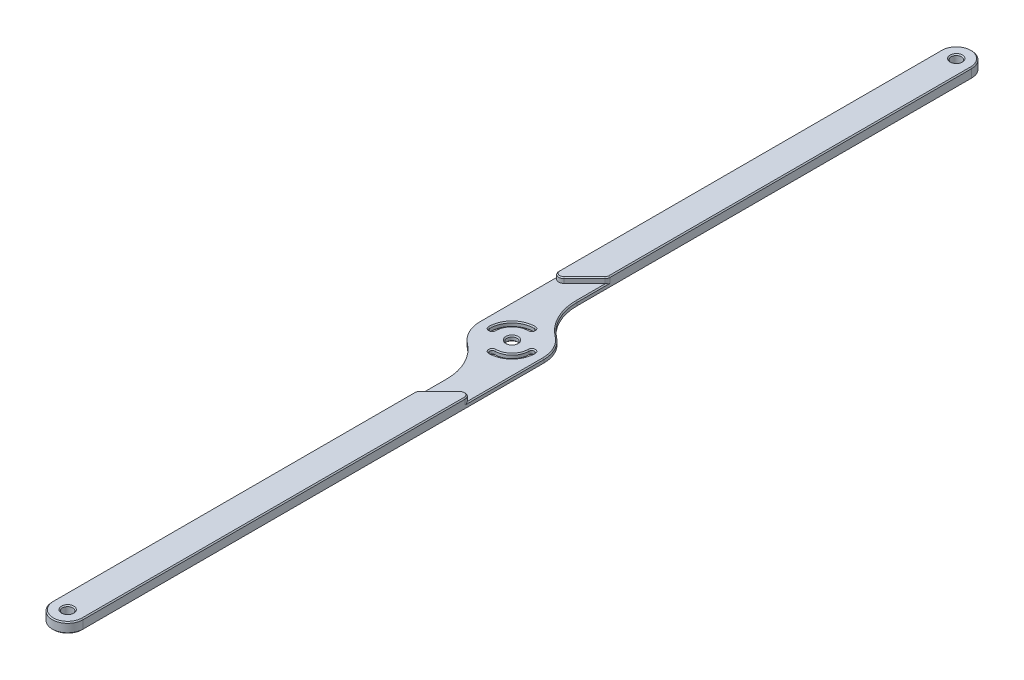
from build123d import *

# Parameters (mm, degrees)
SKETCH_1_R          = 1
EXTRUDE_1_DEPTH     = 2
EXTRUDE_1_2_DEPTH   = 2
EXTRUDE_2_DEPTH     = 1
SKETCH_2_R          = 1
CUT_EXTRUDE_1_DEPTH = 3.5
CHAMFER_1_SIZE      = 0.2
CHAMFER_2_SIZE      = 0.2
CHAMFER_4_SIZE      = 0.2
CHAMFER_5_SIZE      = 0.2
CHAMFER_6_SIZE      = 0.2


with BuildPart() as part:
    # 草图1 → 凸台-拉伸1 (new body)
    with BuildSketch(Plane(origin=(0, 0, 0), x_dir=(1, 0, 0), z_dir=(0, 1, 0))):
        with BuildLine():
            Line((-32.564554557, -24.990133986), (-36.564554557, -28.990133986))
            ThreePointArc((-36.564554557, -28.990133986), (-36.781327308, -29.314557334), (-36.857447775, -29.697240767))
            Line((-36.857447775, -29.697240767), (-36.857447775, -100.283027204))
            ThreePointArc((-36.857447775, -100.283027204), (-33.857447775, -103.283027204), (-30.857447775, -100.283027204))
            Line((-30.857447775, -100.283027204), (-30.857447775, -25.697240767))
            ThreePointArc((-30.857447775, -25.697240767), (-31.474764343, -24.773361234), (-32.564554557, -24.990133986))
        make_face()
        with Locations((-33.857447775, -100.283027204)):
            Circle(SKETCH_1_R, mode=Mode.SUBTRACT)
    extrude(amount=EXTRUDE_1_DEPTH)



with BuildPart() as body_2:
    # 草图1 → Extrude 1 2 (new body)
    with BuildSketch(Plane(origin=(0, 0, 0), x_dir=(1, 0, 0), z_dir=(0, 1, 0))):
        with BuildLine():
            Line((-43.286707561, 79.575105321), (-43.286707561, 4.989318884))
            ThreePointArc((-43.286707561, 4.989318884), (-42.669390994, 4.065439351), (-41.57960078, 4.282212103))
            Line((-41.57960078, 4.282212103), (-37.57960078, 8.282212103))
            ThreePointArc((-37.57960078, 8.282212103), (-37.362828029, 8.606635451), (-37.286707561, 8.989318884))
            Line((-37.286707561, 8.989318884), (-37.286707561, 79.575105321))
            ThreePointArc((-37.286707561, 79.575105321), (-40.286707561, 82.575105321), (-43.286707561, 79.575105321))
        make_face()
        with Locations((-40.286707561, 79.575105321)):
            Circle(SKETCH_1_R, mode=Mode.SUBTRACT)
    extrude(amount=EXTRUDE_1_2_DEPTH)


with BuildPart() as part_1:
    add(part.part)

    add(body_2.part)  # 凸台-拉伸2 merges body 2
    # 草图1<3> → 凸台-拉伸2 (add)
    with BuildSketch(Plane(origin=(0, 0, 0), x_dir=(1, 0, 0), z_dir=(0, 1, 0))):
        with BuildLine():
            ThreePointArc((-36.857447775, -29.697240767), (-36.781327308, -29.314557334), (-36.564554557, -28.990133986))
            Line((-36.564554557, -28.990133986), (-32.564554557, -24.990133986))
            ThreePointArc((-32.564554557, -24.990133986), (-31.474764343, -24.773361234), (-30.857447775, -25.697240767))
            Line((-30.857447775, -25.697240767), (-30.857447775, -10.353960941))
            ThreePointArc((-30.857447775, -10.353960941), (-31.507484403, -7.586845747), (-33.321609481, -5.398598888))
            ThreePointArc((-33.321609481, -5.398598888), (-36.24072954, -1.87747712), (-37.286707561, 2.575105321))
            Line((-37.286707561, 2.575105321), (-37.286707561, 8.989318884))
            ThreePointArc((-37.286707561, 8.989318884), (-37.362828029, 8.606635451), (-37.57960078, 8.282212103))
            Line((-37.57960078, 8.282212103), (-41.57960078, 4.282212103))
            ThreePointArc((-41.57960078, 4.282212103), (-42.669390994, 4.065439351), (-43.286707561, 4.989318884))
            Line((-43.286707561, 4.989318884), (-43.286707561, -10.353960941))
            ThreePointArc((-43.286707561, -10.353960941), (-42.636670934, -13.121076136), (-40.822545856, -15.309322995))
            ThreePointArc((-40.822545856, -15.309322995), (-37.903425797, -18.830444763), (-36.857447775, -23.283027204))
            Line((-36.857447775, -23.283027204), (-36.857447775, -29.697240767))
        make_face()
    extrude(amount=EXTRUDE_2_DEPTH)

    # 草图2 → 切除-拉伸1 (cut)
    with BuildSketch(Plane(origin=(0, 1, 0), x_dir=(1, 0, 0), z_dir=(0, 1, 0))):
        with Locations((-37.072077668, -10.353960941)):
            Circle(SKETCH_2_R)
        with BuildLine():
            ThreePointArc((-37.072077668, -5.999383373), (-40.151228996, -7.274809613), (-41.426655237, -10.353960941))
            ThreePointArc((-41.426655237, -10.353960941), (-40.926655237, -10.853960941), (-40.426655237, -10.353960941))
            ThreePointArc((-40.426655237, -10.353960941), (-39.444122215, -7.981916395), (-37.072077668, -6.999383373))
            ThreePointArc((-37.072077668, -6.999383373), (-36.572077668, -6.499383373), (-37.072077668, -5.999383373))
        make_face()
        with BuildLine():
            ThreePointArc((-37.072077668, -14.70853851), (-33.99292634, -13.43311227), (-32.7175001, -10.353960941))
            ThreePointArc((-32.7175001, -10.353960941), (-33.2175001, -9.853960941), (-33.7175001, -10.353960941))
            ThreePointArc((-33.7175001, -10.353960941), (-34.700033121, -12.726005488), (-37.072077668, -13.70853851))
            ThreePointArc((-37.072077668, -13.70853851), (-37.572077668, -14.20853851), (-37.072077668, -14.70853851))
        make_face()
    extrude(amount=-CUT_EXTRUDE_1_DEPTH, mode=Mode.SUBTRACT)

    # 倒角1
    chamfer_1_edges = [part_1.edges().sort_by_distance(p)[0] for p in [
        (-30.857447775, 0, 55.318494073),
        (-31.507484403, 0, 7.586845747),
        (-36.24072954, 0, 1.87747712),
        (-36.857447775, 0, 61.783027204),
        (-37.286707561, 0, -41.075105321),
        (-37.903425797, 0, 18.830444763),
        (-42.636670934, 0, 13.121076136),
        (-43.286707561, 0, -34.61057219),
        (-37.362828029, 2, -8.606635451),
        (-37.286707561, 2, -44.282212103),
        (-39.57960078, 2, -6.282212103),
        (-42.669390994, 2, -4.065439351),
        (-43.286707561, 2, -42.282212103),
        (-33.857447775, 0, 103.283027204),
        (-40.286707561, 0, -82.575105321),
        (-40.286707561, 2, -82.575105321),
    ]]
    chamfer(chamfer_1_edges, length=CHAMFER_1_SIZE)

    # 倒角2
    chamfer_2_edges = [part_1.edges().sort_by_distance(p)[0] for p in [
        (-36.781327308, 2, 29.314557334),
        (-34.564554557, 2, 26.990133986),
        (-36.857447775, 2, 64.990133986),
        (-31.474764343, 2, 24.773361234),
        (-30.857447775, 2, 62.990133986),
        (-33.857447775, 2, 103.283027204),
    ]]
    chamfer(chamfer_2_edges, length=CHAMFER_2_SIZE)

    # 倒角4
    chamfer_4_edges = [part_1.edges().sort_by_distance(p)[0] for p in [
        (-37.286707561, 1, -5.782212103),
        (-36.24072954, 1, 1.87747712),
        (-31.507484403, 1, 7.586845747),
        (-30.857447775, 1, 18.025600854),
    ]]
    chamfer(chamfer_4_edges, length=CHAMFER_4_SIZE)

    # 倒角5
    chamfer_5_edges = [part_1.edges().sort_by_distance(p)[0] for p in [
        (-33.99292634, 0, 13.43311227),
        (-33.2175001, 0, 9.853960941),
        (-37.572077668, 0, 14.20853851),
        (-34.700033121, 0, 12.726005488),
        (-33.99292634, 1, 13.43311227),
        (-33.2175001, 1, 9.853960941),
        (-37.572077668, 1, 14.20853851),
        (-34.700033121, 1, 12.726005488),
        (-38.072077668, 0, 10.353960941),
        (-38.072077668, 1, 10.353960941),
        (-39.444122215, 1, 7.981916395),
        (-36.572077668, 1, 6.499383373),
        (-40.926655237, 1, 10.853960941),
        (-40.151228996, 1, 7.274809613),
        (-39.444122215, 0, 7.981916395),
        (-36.572077668, 0, 6.499383373),
        (-40.926655237, 0, 10.853960941),
        (-40.151228996, 0, 7.274809613),
        (-41.286707561, 2, -79.575105321),
        (-41.286707561, 0, -79.575105321),
    ]]
    chamfer(chamfer_5_edges, length=CHAMFER_5_SIZE)

    # 倒角6
    chamfer_6_edges = [part_1.edges().sort_by_distance(p)[0] for p in [
        (-34.857447775, 0, 100.283027204),
        (-34.857447775, 2, 100.283027204),
    ]]
    chamfer(chamfer_6_edges, length=CHAMFER_6_SIZE)


solid = part_1.part
